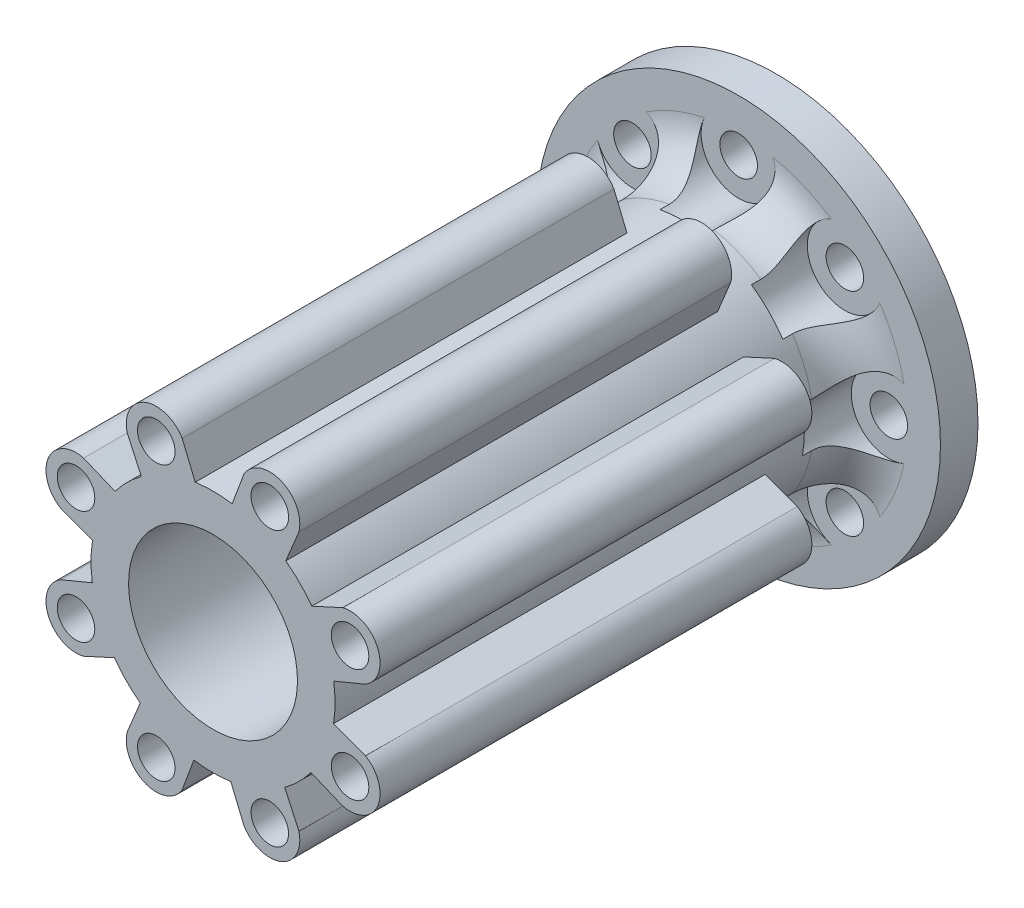
from build123d import *

# Parameters (mm, degrees)
CROQUIS1_R                    = 9.5
CROQUIS1_R_2                  = 4.5
SALIENTE_EXTRUIR1_DEPTH       = 2
CROQUIS2_R                    = 0.8
CORTAR_EXTRUIR3_DEPTH         = 2
CROQUIS3_R                    = 6.5
CROQUIS3_R_2                  = 4.5
SALIENTE_EXTRUIR2_DEPTH       = 28
SALIENTE_EXTRUIR3_START       = -28
SALIENTE_EXTRUIR3_DEPTH       = 28
CROQUIS5_R                    = 1
CORTAR_EXTRUIR4_DEPTH         = 5
SALIENTE_EXTRUIR4_START       = -2
SALIENTE_EXTRUIR4_OUTLINE_R   = 10.75
SALIENTE_EXTRUIR4_OUTLINE_R_2 = 9.5
SALIENTE_EXTRUIR4_DEPTH       = 2
CROQUIS7_R                    = 1
CORTAR_EXTRUIR5_DEPTH         = 10
CROQUIS8_R                    = 10.75
CROQUIS8_R_2                  = 6.5
CORTAR_EXTRUIR6_DEPTH         = 5
CROQUIS9_R                    = 2
CORTAR_EXTRUIR7_DEPTH         = 3
REDONDEO1_R                   = 2.5
CROQUIS11_R                   = 3.25
CORTAR_EXTRUIR8_DEPTH         = 9


# Read off the part's stored shape, not the designer's step: Saliente-Extruir4
with BuildPart() as part:
    # Croquis1 → Saliente-Extruir1 (new body)
    with BuildSketch(Plane.XY):
        Circle(CROQUIS1_R)
        Circle(CROQUIS1_R_2, mode=Mode.SUBTRACT)
    extrude(amount=SALIENTE_EXTRUIR1_DEPTH)

    # Croquis2 → Cortar-Extruir3 (cut)
    with BuildSketch(Plane.XY.offset(2)):
        with Locations((0, -8)):
            Circle(CROQUIS2_R)
        with Locations((-5.656854249, -5.656854249)):
            Circle(CROQUIS2_R)
        with Locations((-8, 0)):
            Circle(CROQUIS2_R)
        with Locations((-5.656854249, 5.656854249)):
            Circle(CROQUIS2_R)
        with Locations((5.656854249, -5.656854249)):
            Circle(CROQUIS2_R)
        with Locations((8, 0)):
            Circle(CROQUIS2_R)
        with Locations((0, 8)):
            Circle(CROQUIS2_R)
        with Locations((5.656854249, 5.656854249)):
            Circle(CROQUIS2_R)
    extrude(amount=-CORTAR_EXTRUIR3_DEPTH, mode=Mode.SUBTRACT)

    # Croquis3 → Saliente-Extruir2 (add)
    with BuildSketch(Plane.XY.offset(2)):
        with Locations(Location((0, 0, 0), (0, 0, 180))):
            Circle(CROQUIS3_R)
        with Locations(Location((0, 0, 0), (0, 0, 90))):
            Circle(CROQUIS3_R_2, mode=Mode.SUBTRACT)
    extrude(amount=SALIENTE_EXTRUIR2_DEPTH)

    # Croquis4 → Saliente-Extruir3 (add)
    with BuildSketch(Plane.XY.offset(30).offset(SALIENTE_EXTRUIR3_START)):
        with BuildLine():
            Line((6.430463077, 0.948232365), (8.108527681, 1.643309482))
            ThreePointArc((8.108527681, 1.643309482), (8.779881426, 3.628135845), (6.911006272, 4.575530798))
            Line((6.911006272, 4.575530798), (5.259667833, 3.819148371))
            ThreePointArc((5.259667833, 3.819148371), (6.018748197, 2.45452035), (6.430463077, 0.948232365))
        make_face()
        with BuildLine():
            Line((5.217525583, -3.876522512), (6.895590187, -4.57159963))
            ThreePointArc((6.895590187, -4.57159963), (8.773793153, -3.642834236), (8.122208254, -1.651430545))
            Line((8.122208254, -1.651430545), (6.419692504, -1.01860108))
            ThreePointArc((6.419692504, -1.01860108), (5.991505648, -2.52028968), (5.217525583, -3.876522512))
        make_face()
        with BuildLine():
            Line((0.948232365, -6.430463077), (1.643309482, -8.108527681))
            ThreePointArc((1.643309482, -8.108527681), (3.628135845, -8.779881426), (4.575530798, -6.911006272))
            Line((4.575530798, -6.911006272), (3.819148371, -5.259667833))
            ThreePointArc((3.819148371, -5.259667833), (2.45452035, -6.018748197), (0.948232365, -6.430463077))
        make_face()
        with BuildLine():
            Line((-3.876522512, -5.217525583), (-4.57159963, -6.895590187))
            ThreePointArc((-4.57159963, -6.895590187), (-3.642834236, -8.773793153), (-1.651430545, -8.122208254))
            Line((-1.651430545, -8.122208254), (-1.01860108, -6.419692504))
            ThreePointArc((-1.01860108, -6.419692504), (-2.52028968, -5.991505648), (-3.876522512, -5.217525583))
        make_face()
        with BuildLine():
            Line((-6.430463077, -0.948232365), (-8.108527681, -1.643309482))
            ThreePointArc((-8.108527681, -1.643309482), (-8.779881426, -3.628135845), (-6.911006272, -4.575530798))
            Line((-6.911006272, -4.575530798), (-5.259667833, -3.819148371))
            ThreePointArc((-5.259667833, -3.819148371), (-6.018748197, -2.45452035), (-6.430463077, -0.948232365))
        make_face()
        with BuildLine():
            Line((-5.217525583, 3.876522512), (-6.895590187, 4.57159963))
            ThreePointArc((-6.895590187, 4.57159963), (-8.773793153, 3.642834236), (-8.122208254, 1.651430545))
            Line((-8.122208254, 1.651430545), (-6.419692504, 1.01860108))
            ThreePointArc((-6.419692504, 1.01860108), (-5.991505648, 2.52028968), (-5.217525583, 3.876522512))
        make_face()
        with BuildLine():
            Line((-0.948232365, 6.430463077), (-1.643309482, 8.108527681))
            ThreePointArc((-1.643309482, 8.108527681), (-3.628135845, 8.779881426), (-4.575530798, 6.911006272))
            Line((-4.575530798, 6.911006272), (-3.819148371, 5.259667833))
            ThreePointArc((-3.819148371, 5.259667833), (-2.45452035, 6.018748197), (-0.948232365, 6.430463077))
        make_face()
        with BuildLine():
            Line((3.876522512, 5.217525583), (4.57159963, 6.895590187))
            ThreePointArc((4.57159963, 6.895590187), (3.642834236, 8.773793153), (1.651430545, 8.122208254))
            Line((1.651430545, 8.122208254), (1.01860108, 6.419692504))
            ThreePointArc((1.01860108, 6.419692504), (2.52028968, 5.991505648), (3.876522512, 5.217525583))
        make_face()
    extrude(amount=SALIENTE_EXTRUIR3_DEPTH)

    # Croquis5 → Cortar-Extruir4 (cut)
    with BuildSketch(Plane.XY.offset(30)):
        with Locations((-3.023199116, 7.298648307)):
            Circle(CROQUIS5_R)
        with Locations((3.023199116, 7.298648307)):
            Circle(CROQUIS5_R)
        with Locations((7.298648307, 3.023199116)):
            Circle(CROQUIS5_R)
        with Locations((7.298648307, -3.023199116)):
            Circle(CROQUIS5_R)
        with Locations((3.023199116, -7.298648307)):
            Circle(CROQUIS5_R)
        with Locations((-3.023199116, -7.298648307)):
            Circle(CROQUIS5_R)
        with Locations((-7.298648307, -3.023199116)):
            Circle(CROQUIS5_R)
        with Locations((-7.298648307, 3.023199116)):
            Circle(CROQUIS5_R)
    extrude(amount=-CORTAR_EXTRUIR4_DEPTH, mode=Mode.SUBTRACT)

    # Saliente-Extruir4 outline → Saliente-Extruir4 (add)
    with BuildSketch(Plane(origin=(0, 0, 0), x_dir=(-1, 0, 0), z_dir=(0, 0, -1)).offset(SALIENTE_EXTRUIR4_START)):
        Circle(SALIENTE_EXTRUIR4_OUTLINE_R)
        Circle(SALIENTE_EXTRUIR4_OUTLINE_R_2, mode=Mode.SUBTRACT)
    extrude(amount=SALIENTE_EXTRUIR4_DEPTH)

    # Croquis7 → Cortar-Extruir5 (cut)
    with BuildSketch(Plane.XY.offset(2)):
        with Locations((-5.656854249, 5.656854249)):
            Circle(CROQUIS7_R)
        with Locations((0, 8)):
            Circle(CROQUIS7_R)
        with Locations((5.656854249, 5.656854249)):
            Circle(CROQUIS7_R)
        with Locations((8, 0)):
            Circle(CROQUIS7_R)
        with Locations((5.656854249, -5.656854249)):
            Circle(CROQUIS7_R)
        with Locations((0, -8)):
            Circle(CROQUIS7_R)
        with Locations((-5.656854249, -5.656854249)):
            Circle(CROQUIS7_R)
        with Locations((-8, 0)):
            Circle(CROQUIS7_R)
    extrude(amount=-CORTAR_EXTRUIR5_DEPTH, mode=Mode.SUBTRACT)

    # Croquis8 → Cortar-Extruir6 (cut)
    with BuildSketch(Plane.XY.offset(2)):
        with Locations(Location((0, 0, 0), (0, 0, 180))):
            Circle(CROQUIS8_R)
        with Locations(Location((0, 0, 0), (0, 0, 188.388351526))):
            Circle(CROQUIS8_R_2, mode=Mode.SUBTRACT)
    extrude(amount=CORTAR_EXTRUIR6_DEPTH, mode=Mode.SUBTRACT)

    # Croquis9 → Cortar-Extruir7 (cut)
    with BuildSketch(Plane.XY.offset(2)):
        with Locations((0, -8)):
            Circle(CROQUIS9_R)
        with Locations((5.656854249, -5.656854249)):
            Circle(CROQUIS9_R)
        with Locations((8, 0)):
            Circle(CROQUIS9_R)
        with Locations((5.656854249, 5.656854249)):
            Circle(CROQUIS9_R)
        with Locations((0, 8)):
            Circle(CROQUIS9_R)
        with Locations((-5.656854249, 5.656854249)):
            Circle(CROQUIS9_R)
        with Locations((-8, 0)):
            Circle(CROQUIS9_R)
        with Locations((-5.656854249, -5.656854249)):
            Circle(CROQUIS9_R)
    extrude(amount=CORTAR_EXTRUIR7_DEPTH, mode=Mode.SUBTRACT)

    # Redondeo1
    redondeo1_edges = [part.edges().sort_by_distance(p)[0] for p in [
        (2.48744231, 6.005216961, 2),
        (-2.48744231, 6.005216961, 2),
        (-6.005216961, 2.48744231, 2),
        (-6.005216961, -2.48744231, 2),
        (-2.48744231, -6.005216961, 2),
        (2.48744231, -6.005216961, 2),
        (6.005216961, -2.48744231, 2),
        (6.005216961, 2.48744231, 2),
    ]]
    fillet(redondeo1_edges, radius=REDONDEO1_R - 0.0001)  # a hair under: the kernel refuses the full size

    # Croquis11 → Cortar-Extruir8 (cut)
    with BuildSketch(Plane(origin=(0, 0, 0), x_dir=(1, 0, 0), z_dir=(0, 1, 0))):
        with Locations(Location((0, -13, 0), (0, 0, 270))):
            Circle(CROQUIS11_R)
    extrude(amount=-CORTAR_EXTRUIR8_DEPTH, mode=Mode.SUBTRACT)


solid = part.part
